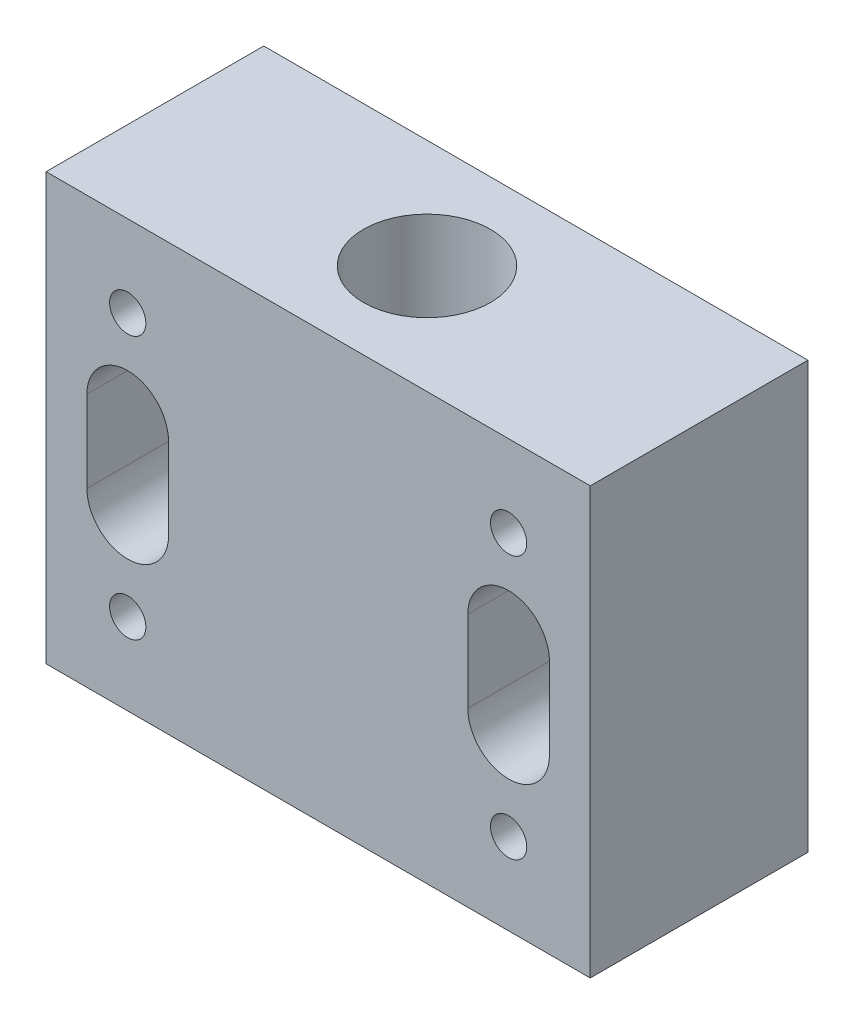
from build123d import *

# Parameters (mm, degrees)
SKETCH2_W           = 60
SKETCH2_H           = 24
SKETCH2_R           = 7
BOSS_EXTRUDE1_DEPTH = 47
SKETCH2_2_W         = 60
SKETCH2_2_H         = 24
SKETCH2_2_R         = 7
BOSS_EXTRUDE2_DEPTH = 25.5
SKETCH8_R           = 2
CUT_EXTRUDE1_DEPTH  = 61.704200843
CUT_EXTRUDE2_DEPTH  = 61.704200843
SKETCH10_R          = 2
CUT_EXTRUDE3_DEPTH  = 10


with BuildPart() as part:
    # Sketch2 → Boss-Extrude1 (new body)
    with BuildSketch(Plane(origin=(0, 0, 0), x_dir=(1, 0, 0), z_dir=(0, 1, 0))):
        Rectangle(SKETCH2_W, SKETCH2_H)
        Circle(SKETCH2_R, mode=Mode.SUBTRACT)
    extrude(amount=BOSS_EXTRUDE1_DEPTH)

    # Sketch2<2> → Boss-Extrude2 (add)
    with BuildSketch(Plane(origin=(0, 0, 0), x_dir=(1, 0, 0), z_dir=(0, 1, 0))):
        Rectangle(SKETCH2_2_W, SKETCH2_2_H)
        Circle(SKETCH2_2_R, mode=Mode.SUBTRACT)
    extrude(amount=BOSS_EXTRUDE2_DEPTH)

    # Sketch8 → Cut-Extrude1 (cut, through all)
    with BuildSketch(Plane.XY.offset(12)):
        with Locations((-21, 9)):
            Circle(SKETCH8_R)
        with Locations((-21, 38)):
            Circle(SKETCH8_R)
        with Locations((21, 38)):
            Circle(SKETCH8_R)
        with Locations((21, 9)):
            Circle(SKETCH8_R)
    extrude(amount=-CUT_EXTRUDE1_DEPTH, mode=Mode.SUBTRACT)

    # Sketch9 → Cut-Extrude2 (cut, through all)
    with BuildSketch(Plane.XY.offset(12)):
        with BuildLine():
            Line((-25.5, 19), (-25.5, 28))
            ThreePointArc((-25.5, 28), (-21, 32.5), (-16.5, 28))
            Line((-16.5, 28), (-16.5, 19))
            ThreePointArc((-16.5, 19), (-21, 14.5), (-25.5, 19))
        make_face()
        with BuildLine():
            Line((25.5, 19), (25.5, 28))
            ThreePointArc((25.5, 28), (21, 32.5), (16.5, 28))
            Line((16.5, 28), (16.5, 19))
            ThreePointArc((16.5, 19), (21, 14.5), (25.5, 19))
        make_face()
    extrude(amount=-CUT_EXTRUDE2_DEPTH, mode=Mode.SUBTRACT)

    # Sketch10 → Cut-Extrude3 (cut)
    with BuildSketch(Plane(origin=(0, 0, -12), x_dir=(-1, 0, 0), z_dir=(0, 0, -1))):
        with Locations((14.2, 42.5)):
            Circle(SKETCH10_R)
        with Locations((14.2, 4.5)):
            Circle(SKETCH10_R)
        with Locations((-15.8, 4.5)):
            Circle(SKETCH10_R)
        with Locations((-15.8, 42.5)):
            Circle(SKETCH10_R)
    extrude(amount=-CUT_EXTRUDE3_DEPTH, mode=Mode.SUBTRACT)


solid = part.part
